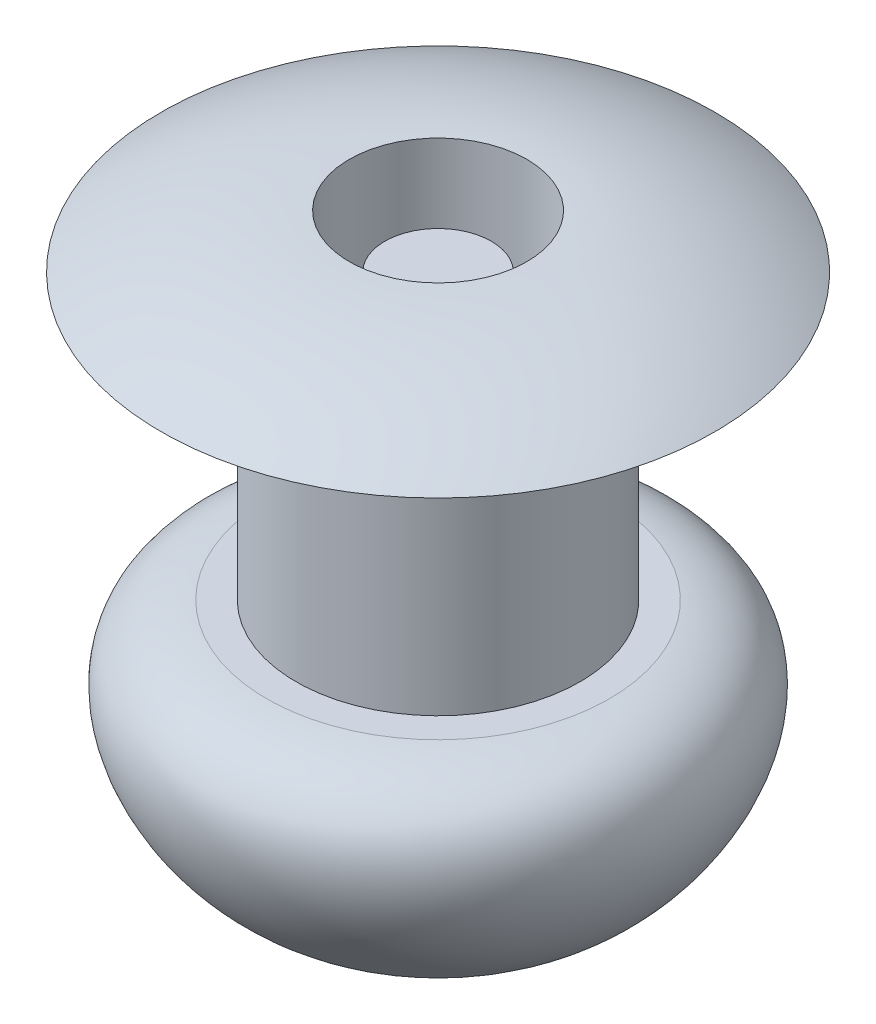
from build123d import *


with BuildPart() as part:
    # Szkic1 → Obrót1 (revolve)
    with BuildSketch(Plane(origin=(0, 0, 0), x_dir=(0, 0, -1), z_dir=(1, 0, 0))):
        with BuildLine():
            Line((0, 0), (0, -4.000000045))
            Line((0, -4.000000045), (0, -5.500000045))
            add(Edge.make_bspline(
                [(-0.956030427, -5.378190715), (-0.520263876, -5.500000045), (0, -5.500000045)],
                knots=[0.992852221, 0.992852221, 0.992852221, 1.570796327, 1.570796327, 1.570796327], degree=2, weights=[1, 0.958537313, 1]))
            add(Edge.make_bspline(
                [(-2.413891755, -4.000000045), (-3.858559437, -4.163296731), (-3.558358928, -6.322980407), (-0.971318098, -7.871940061), (-0.341145137, -5.792031954), (-0.956030427, -5.378190715)],
                knots=[0, 0, 0, 0, 0.454219308, 0.705200672, 1, 1, 1, 1], degree=3))
            Line((-2.413891755, -4.000000045), (-2, -4.000000045))
            Line((-2, -4.000000045), (-2, 0))
            Line((-2, 0), (-3.9, 0))
            ThreePointArc((-3.9, 0), (-2.627043935, 0.558888572), (-1.25, 0.75))
            Line((-1.25, 0.75), (-1.25, -4.000000045))
            Line((-1.25, -4.000000045), (-0.75, -4.000000045))
            Line((-0.75, -4.000000045), (-0.75, 0))
            Line((-0.75, 0), (0, 0))
        make_face()
    revolve(axis=Axis((0, 0, 0), (0, 1, 0)))


solid = part.part
